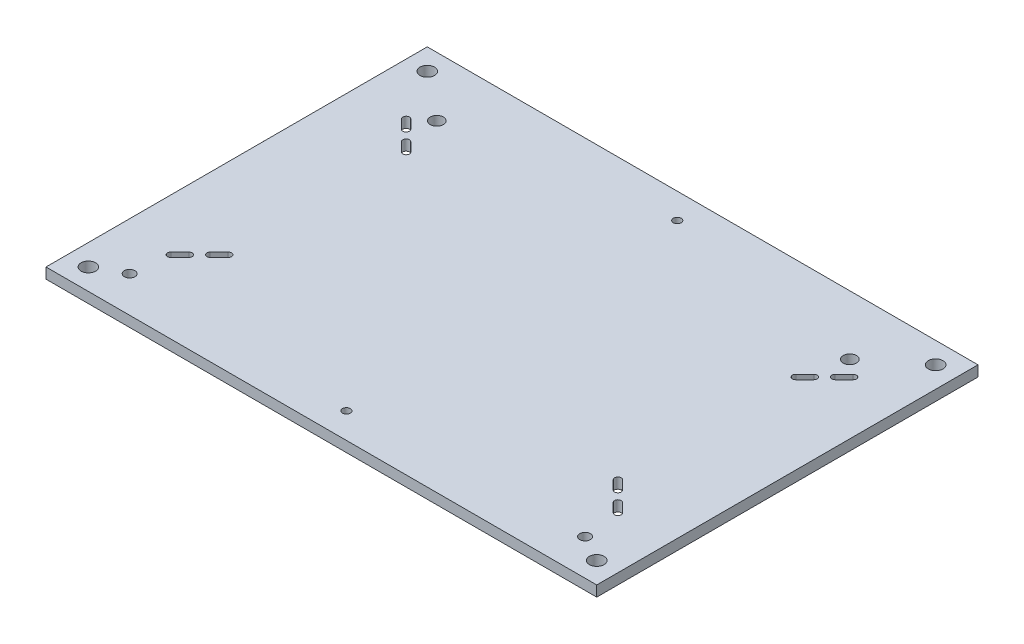
from build123d import *

# Parameters (mm, degrees)
SKETCH1_W                      = 330.2
SKETCH1_H                      = 228.6
BASE_PLATE_DEPTH               = 6.35
SLOTS_DEPTH                    = 402.659460862
FEET_CONNECTION_HOLE_D         = 8.7376
F_1_4_0_25_DIAMETER_HOLE1_D    = 6.35
F_5_16_0_3125_DIAMETER_HOLE1_D = 7.9375
ESD_CONNECTION_HOLE_D          = 4.7625


with BuildPart() as part:
    # Sketch1 → base plate (new body)
    with BuildSketch(Plane(origin=(0, 0, 0), x_dir=(1, 0, 0), z_dir=(0, 1, 0))):
        with Locations((165.1, -114.3)):
            Rectangle(SKETCH1_W, SKETCH1_H)
    extrude(amount=-BASE_PLATE_DEPTH)

    # Sketch3 → slots (cut, through all)
    with BuildSketch(Plane(origin=(0, 0, 0), x_dir=(1, 0, 0), z_dir=(0, 1, 0))):
        with BuildLine():
            Line((35.054508291, -178.017064493), (29.666354619, -183.405218166))
            ThreePointArc((29.666354619, -183.405218166), (29.666354619, -186.233645381), (32.494781834, -186.233645381))
            Line((32.494781834, -186.233645381), (37.882935507, -180.845491709))
            ThreePointArc((37.882935507, -180.845491709), (37.882935507, -178.017064493), (35.054508291, -178.017064493))
        make_face()
        with BuildLine():
            Line((44.30346517, -174.424962045), (49.691618843, -169.036808372))
            ThreePointArc((49.691618843, -169.036808372), (49.691618843, -166.208381157), (46.863191628, -166.208381157))
            Line((46.863191628, -166.208381157), (41.475037955, -171.59653483))
            ThreePointArc((41.475037955, -171.59653483), (41.475037955, -174.424962045), (44.30346517, -174.424962045))
        make_face()
        with BuildLine():
            ThreePointArc((32.494781834, -42.366354619), (29.666354619, -42.366354619), (29.666354619, -45.194781834))
            Line((29.666354619, -45.194781834), (35.054508291, -50.582935507))
            ThreePointArc((35.054508291, -50.582935507), (37.882935507, -50.582935507), (37.882935507, -47.754508291))
            Line((37.882935507, -47.754508291), (32.494781834, -42.366354619))
        make_face()
        with BuildLine():
            ThreePointArc((46.863191628, -62.391618843), (49.691618843, -62.391618843), (49.691618843, -59.563191628))
            Line((49.691618843, -59.563191628), (44.30346517, -54.175037955))
            ThreePointArc((44.30346517, -54.175037955), (41.475037955, -54.175037955), (41.475037955, -57.00346517))
            Line((41.475037955, -57.00346517), (46.863191628, -62.391618843))
        make_face()
        with BuildLine():
            Line((295.145491709, -50.582935507), (300.533645381, -45.194781834))
            ThreePointArc((300.533645381, -45.194781834), (300.533645381, -42.366354619), (297.705218166, -42.366354619))
            Line((297.705218166, -42.366354619), (292.317064493, -47.754508291))
            ThreePointArc((292.317064493, -47.754508291), (292.317064493, -50.582935507), (295.145491709, -50.582935507))
        make_face()
        with BuildLine():
            Line((285.89653483, -54.175037955), (280.508381157, -59.563191628))
            ThreePointArc((280.508381157, -59.563191628), (280.508381157, -62.391618843), (283.336808372, -62.391618843))
            Line((283.336808372, -62.391618843), (288.724962045, -57.00346517))
            ThreePointArc((288.724962045, -57.00346517), (288.724962045, -54.175037955), (285.89653483, -54.175037955))
        make_face()
        with BuildLine():
            ThreePointArc((283.336808372, -166.208381157), (280.508381157, -166.208381157), (280.508381157, -169.036808372))
            Line((280.508381157, -169.036808372), (285.89653483, -174.424962045))
            ThreePointArc((285.89653483, -174.424962045), (288.724962045, -174.424962045), (288.724962045, -171.59653483))
            Line((288.724962045, -171.59653483), (283.336808372, -166.208381157))
        make_face()
        with BuildLine():
            ThreePointArc((297.705218166, -186.233645381), (300.533645381, -186.233645381), (300.533645381, -183.405218166))
            Line((300.533645381, -183.405218166), (295.145491709, -178.017064493))
            ThreePointArc((295.145491709, -178.017064493), (292.317064493, -178.017064493), (292.317064493, -180.845491709))
            Line((292.317064493, -180.845491709), (297.705218166, -186.233645381))
        make_face()
    extrude(amount=-SLOTS_DEPTH, mode=Mode.SUBTRACT)

    # Feet connection hole (through all)
    with Locations(Plane(origin=(0, 0, 0), x_dir=(1, 0, 0), z_dir=(0, 1, 0))):
        with Locations((12.7, -215.9), (317.5, -12.7), (317.5, -215.9), (12.7, -12.7)):
            Hole(FEET_CONNECTION_HOLE_D / 2)

    # 1/4 (0.25) Diameter Hole1 (through all)
    with Locations(Plane(origin=(0, 0, 0), x_dir=(1, 0, 0), z_dir=(0, 1, 0))):
        with Locations((28.575, -207.01), (301.625, -207.01)):
            Hole(F_1_4_0_25_DIAMETER_HOLE1_D / 2)

    # 5/16 (0.3125) Diameter Hole1 (through all)
    with Locations(Plane(origin=(0, 0, 0), x_dir=(1, 0, 0), z_dir=(0, 1, 0))):
        with Locations((41.275, -35.56), (288.925, -35.56)):
            Hole(F_5_16_0_3125_DIAMETER_HOLE1_D / 2)

    # ESD Connection hole (through all)
    with Locations(Plane(origin=(0, 0, 0), x_dir=(1, 0, 0), z_dir=(0, 1, 0))):
        with Locations((165.1, -15.24), (164.768662044, -213.266978445)):
            Hole(ESD_CONNECTION_HOLE_D / 2)


solid = part.part
